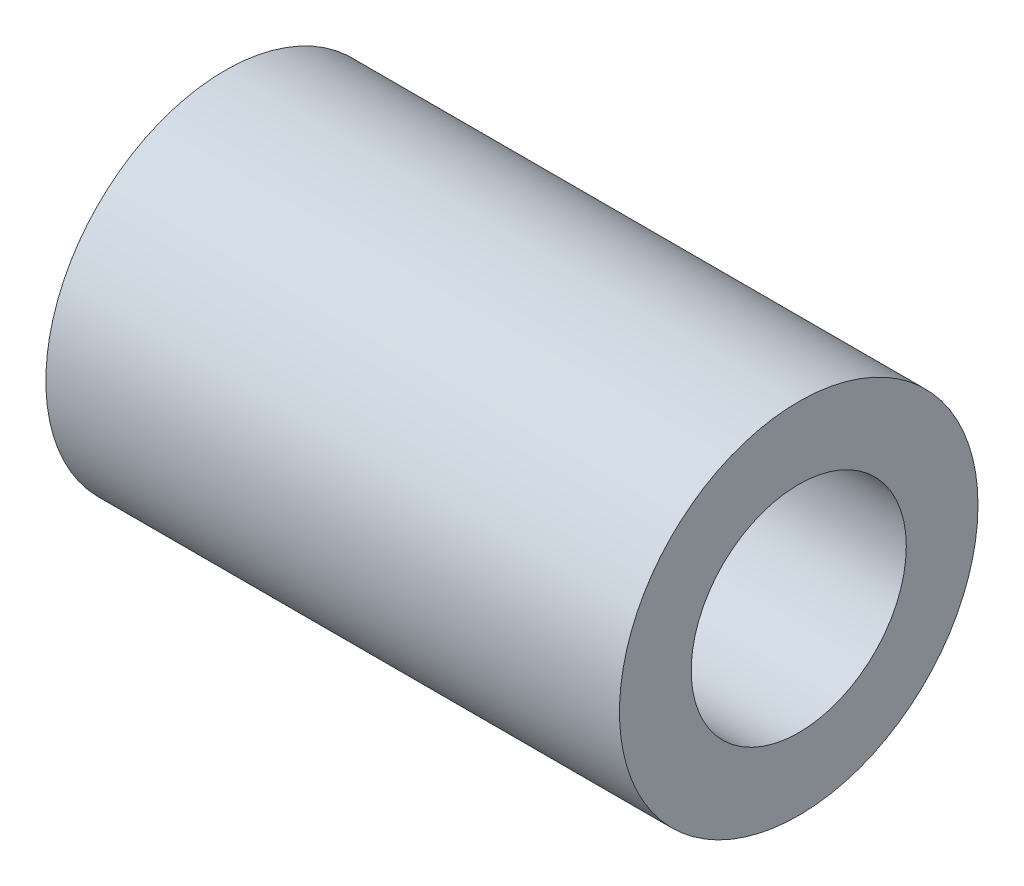
from build123d import *

# Parameters (mm, degrees)
SKETCH1_R           = 7.9375
SKETCH1_R_2         = 4.7625
BOSS_EXTRUDE1_DEPTH = 12.7


with BuildPart() as part:
    # Sketch1 → Boss-Extrude1 (new, symmetric)
    with BuildSketch(Plane(origin=(0, 0, 0), x_dir=(0, 0, -1), z_dir=(1, 0, 0))):
        Circle(SKETCH1_R)
        Circle(SKETCH1_R_2, mode=Mode.SUBTRACT)
    extrude(amount=BOSS_EXTRUDE1_DEPTH, both=True)


solid = part.part
